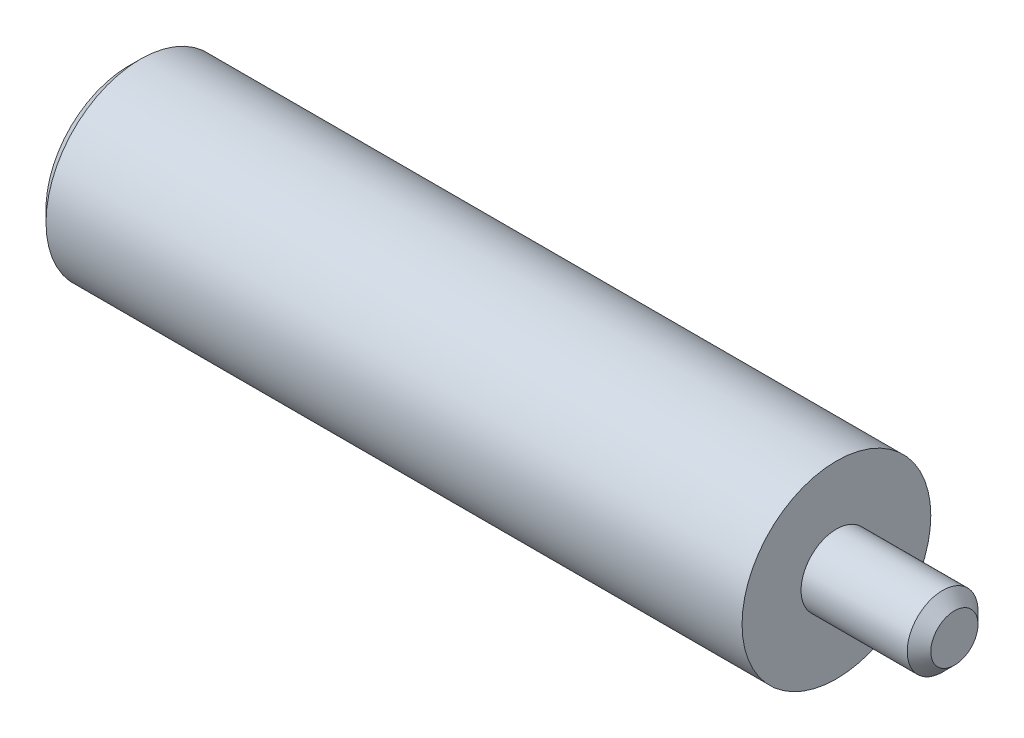
from build123d import *

# Parameters (mm, degrees)
CROQUIS1_R              = 4
SALIENTE_EXTRUIR1_DEPTH = 30
CROQUIS2_R              = 1.5
SALIENTE_EXTRUIR2_DEPTH = 5
CHAFL_N1_SIZE           = 0.5
CHAFL_N2_SIZE           = 0.5


with BuildPart() as part:
    # Croquis1 → Saliente-Extruir1 (new body)
    with BuildSketch(Plane(origin=(0, 0, 0), x_dir=(0, 0, -1), z_dir=(1, 0, 0))):
        Circle(CROQUIS1_R)
    extrude(amount=SALIENTE_EXTRUIR1_DEPTH)

    # Croquis2 → Saliente-Extruir2 (add)
    with BuildSketch(Plane(origin=(30, 0, 0), x_dir=(0, 0, -1), z_dir=(1, 0, 0))):
        Circle(CROQUIS2_R)
    extrude(amount=SALIENTE_EXTRUIR2_DEPTH)

    # Chaflán1
    chafl_n1_edges = [part.edges().sort_by_distance(p)[0] for p in [
        (0, 0, 4),
    ]]
    chamfer(chafl_n1_edges, length=CHAFL_N1_SIZE)

    # Chaflán2
    chafl_n2_edges = [part.edges().sort_by_distance(p)[0] for p in [
        (35, 0, 1.5),
    ]]
    chamfer(chafl_n2_edges, length=CHAFL_N2_SIZE)


solid = part.part
